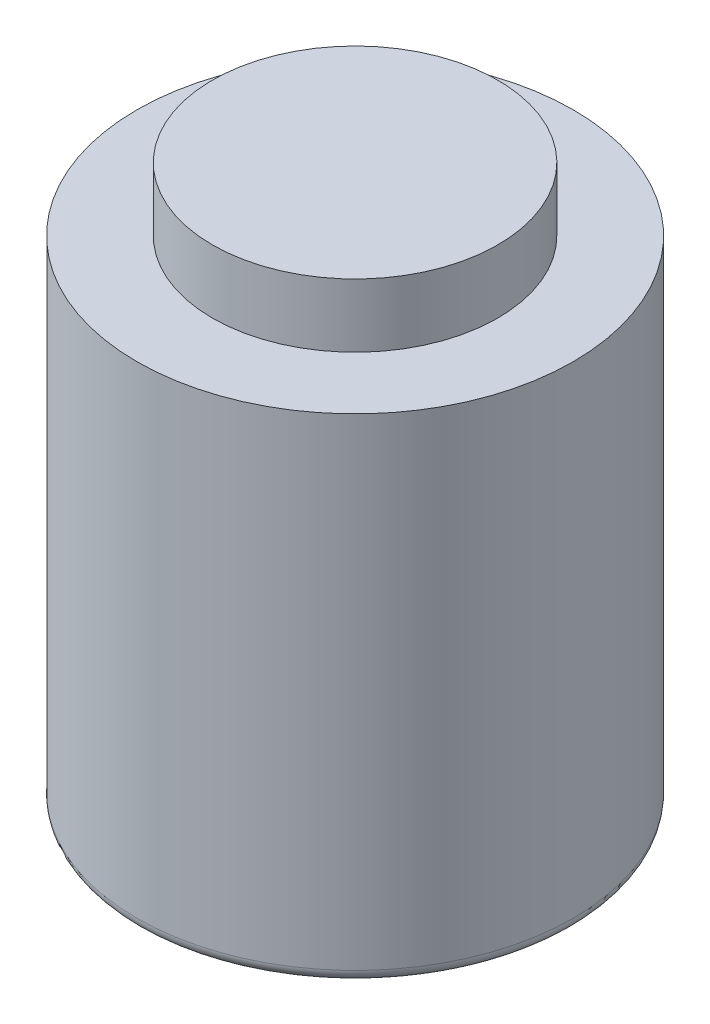
from build123d import *

# Parameters (mm, degrees)
ESBO_O1_R                = 17.2
RESSALTO_EXTRUS_O1_DEPTH = 39
ESBO_O2_R                = 11.25
RESSALTO_EXTRUS_O2_DEPTH = 5
ESBO_O3_R                = 4
RESSALTO_EXTRUS_O3_DEPTH = 3
ESBO_O5_R                = 1
RESSALTO_EXTRUS_O4_DEPTH = 7
PADR_OCIRCULAR1_COUNT    = 6
FILETE1_R                = 1


with BuildPart() as part:
    # Esboço1 → Ressalto-extrusão1 (new body)
    with BuildSketch(Plane(origin=(0, 0, 0), x_dir=(1, 0, 0), z_dir=(0, 1, 0))):
        Circle(ESBO_O1_R)
    extrude(amount=RESSALTO_EXTRUS_O1_DEPTH)

    # Esboço2 → Ressalto-extrusão2 (add)
    with BuildSketch(Plane(origin=(0, 39, 0), x_dir=(1, 0, 0), z_dir=(0, 1, 0))):
        Circle(ESBO_O2_R)
    extrude(amount=RESSALTO_EXTRUS_O2_DEPTH)

    # Esboço3 → Ressalto-extrusão3 (add)
    with BuildSketch(Plane.XZ):
        Circle(ESBO_O3_R)
    extrude(amount=RESSALTO_EXTRUS_O3_DEPTH)

    # Esboço5 → Ressalto-extrusão4 (add)
    with BuildSketch(Plane.XZ.offset(3)):
        Circle(ESBO_O5_R)
    extrude(amount=RESSALTO_EXTRUS_O4_DEPTH)

    # Esboço7 → Furo roscado de M2.51 (revolve, cut)
    with BuildSketch(Plane(origin=(0, 0, 13.5), x_dir=(0, 0, -1), z_dir=(1, 0, 0))):
        Polygon((0, 0), (0, 6), (1.025, 5.384117865), (1.025, 0), align=None)
    furo_roscado_de_m2_51 = revolve(axis=Axis((0, -6.35, 13.5), (0, 1, 0)), mode=Mode.SUBTRACT)

    # PadrãoCircular1: Furo roscado de M2.51 ×6 about axis
    padr_ocircular1_axis = Axis((0, -3, 0), (0, -1, 0))
    for i in range(1, PADR_OCIRCULAR1_COUNT):
        add(furo_roscado_de_m2_51.rotate(padr_ocircular1_axis, i * 360 / PADR_OCIRCULAR1_COUNT), mode=Mode.SUBTRACT)

    # Filete1
    filete1_edges = [part.edges().sort_by_distance(p)[0] for p in [
        (-17.2, 0, 0),
    ]]
    fillet(filete1_edges, radius=FILETE1_R)


solid = part.part
